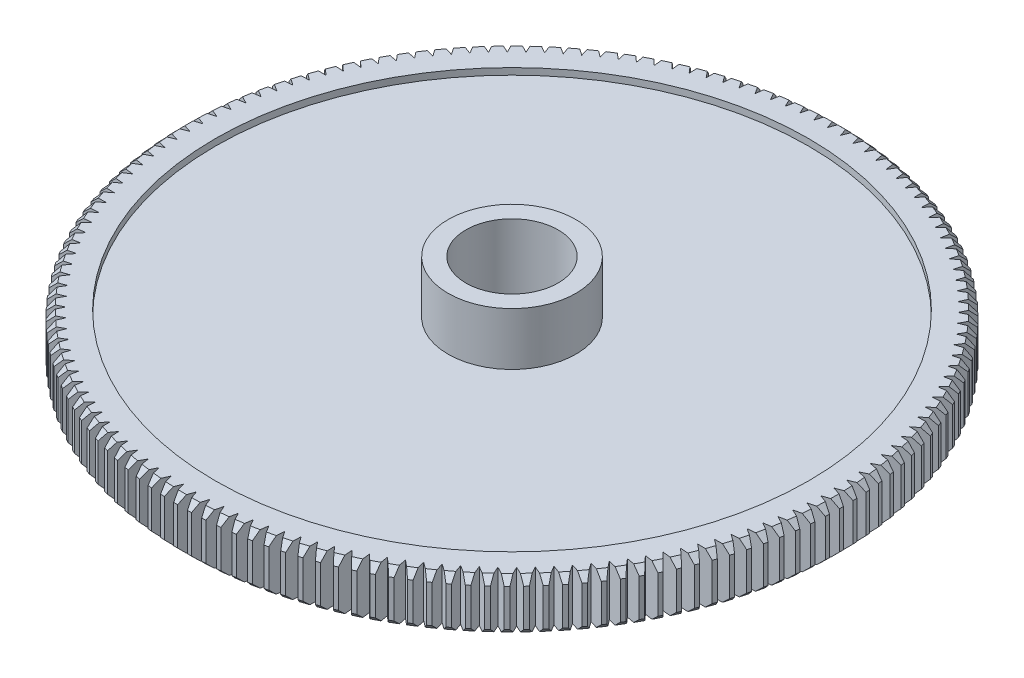
from build123d import *

# Parameters (mm, degrees)
SKETCH_1_R          = 25
EXTRUDE_1_DEPTH     = 3.85
CHAMFER_2_SIZE      = 0.5
CHAMFER_1_SIZE      = 0.5
CUT_EXTRUDE_2_DEPTH = 36.564343098
SKETCH_3_R          = 22.5
CUT_EXTRUDE_3_DEPTH = 0.5
CUT_EXTRUDE_START   = -0.5
SKETCH_4_R          = 22.5
CUT_EXTRUDE_4_DEPTH = 0.5
SKETCH_5_R          = 3.5
CUT_EXTRUDE_5_DEPTH = 36.511758956
EXTRUDE_START       = 4
SKETCH_7_R          = 4.85
SKETCH_7_R_2        = 3.5
EXTRUDE_6_DEPTH     = 4
SKETCH_8_R          = 6.92
SKETCH_8_R_2        = 3.5
EXTRUDE_7_DEPTH     = 9


with BuildPart() as part:
    # Эскиз1 → Вытянуть1 (new body)
    with BuildSketch(Plane(origin=(0, 0, 0), x_dir=(1, 0, 0), z_dir=(0, 1, 0))):
        Circle(SKETCH_1_R)
    extrude(amount=EXTRUDE_1_DEPTH)

    # Фаска2
    chamfer_2_edges = [part.edges().sort_by_distance(p)[0] for p in [
        (-25, 0, 0),
    ]]
    chamfer(chamfer_2_edges, length=CHAMFER_2_SIZE)

    # Фаска1
    chamfer_1_edges = [part.edges().sort_by_distance(p)[0] for p in [
        (-25, 3.85, 0),
    ]]
    chamfer(chamfer_1_edges, length=CHAMFER_1_SIZE)

    # Эскиз2 → Вытянуть2 (cut, through all)
    with BuildSketch(Plane(origin=(0, 3.85, 0), x_dir=(1, 0, 0), z_dir=(0, 1, 0))):
        Polygon((0.562405164, 25.353977291), (1.561527994, 25.312101637), (1.002426509, 23.912456439), align=None)
        Polygon((-0.5, 25.355284493), (0.5, 25.355284493), (0, 23.933454281), align=None)
        Polygon((1.623823677, 25.308182325), (2.620316537, 25.224504481), (2.003094421, 23.84949975), align=None)
        Polygon((2.682393453, 25.217979935), (3.674508154, 25.092646701), (3.000248225, 23.744694662), align=None)
        Polygon((3.736257398, 25.083528366), (4.722253435, 24.916759619), (3.992138574, 23.598225038), align=None)
        Polygon((4.783566679, 24.905063493), (5.76171428, 24.697151802), (4.977025356, 23.410347837), align=None)
        Polygon((5.822483958, 24.682898402), (6.791067119, 24.434208515), (5.953180744, 23.181392657), align=None)
        Polygon((6.851186622, 24.417422848), (7.808506119, 24.128391052), (6.918892229, 22.911761166), align=None)
        Polygon((7.867869976, 24.109102565), (8.812246346, 23.780235918), (7.872465627, 22.601926387), align=None)
        Polygon((8.870750413, 23.758478451), (9.800526899, 23.390353898), (8.812228045, 22.252431877), align=None)
        Polygon((9.85806854, 23.36616562), (10.771613997, 22.959428977), (9.736530821, 21.863890767), align=None)
        Polygon((10.828092264, 22.932852322), (11.723804024, 22.488217143), (10.643752413, 21.43698469), align=None)
        Polygon((11.779119835, 22.459298736), (12.655426515, 21.977545061), (11.532301247, 20.972462586), align=None)
        Polygon((12.709482828, 21.946335635), (13.564847088, 21.428308626), (12.400618505, 20.471139383), align=None)
        Polygon((13.617549068, 21.394862932), (14.450470309, 20.841471382), (13.247180865, 19.933894573), align=None)
        Polygon((14.501725501, 20.805848096), (15.310742495, 20.218062844), (14.070503168, 19.361670665), align=None)
        Polygon((15.360460979, 20.18032446), (16.144154437, 19.55917668), (14.869141028, 18.755471536), align=None)
        Polygon((16.192248989, 19.519389406), (16.949244045, 18.865968802), (15.641693361, 18.116360663), align=None)
        Polygon((16.995630293, 18.824202437), (17.72459892, 18.139655331), (16.38680485, 17.445459266), align=None)
        Polygon((17.769195485, 18.095983148), (18.468858826, 17.381510468), (17.103168314, 16.743944332), align=None)
        Polygon((18.511587471, 17.336009083), (19.180718077, 16.592864257), (17.789527009, 16.013046558), align=None)
        Polygon((19.221503842, 16.545613494), (19.858927832, 15.775100251), (18.444676829, 15.254048186), align=None)
        Polygon((19.897699164, 15.726183004), (20.502298279, 14.929653086), (19.067468419, 14.468280758), align=None)
        Polygon((20.53898716, 14.879155174), (21.109700727, 14.058005964), (19.65680919, 13.657122776), align=None)
        Polygon((21.144242793, 14.006015976), (21.680069588, 13.16168805), (20.211665237, 12.821997288), align=None)
        Polygon((21.71240424, 13.108297194), (22.21240424, 12.242271791), (20.731063157, 11.964369387), align=None)
        Polygon((22.242474752, 12.187573733), (22.705770787, 11.301370154), (21.214091746, 11.085743643), align=None)
        Polygon((22.733524405, 11.245460853), (23.159303696, 10.3406338), (21.659903611, 10.187661466), align=None)
        Polygon((23.184691731, 10.283611341), (23.572207318, 9.361748189), (22.067716644, 9.271698397), align=None)
        Polygon((23.59518523, 9.303712607), (23.943757277, 8.366430618), (22.436815404, 8.339461345), align=None)
        Polygon((23.964284756, 8.307483728), (24.27330175, 7.356427212), (22.766552365, 7.392585771), align=None)
        Polygon((24.291342784, 7.296672427), (24.560262604, 6.33350986), (23.056349057, 6.432732818), align=None)
        Polygon((24.575785542, 6.27305201), (24.804136412, 5.299473107), (23.305697079, 5.461586393), align=None)
        Polygon((24.817114021, 5.238418256), (25.004495336, 4.256131005), (23.514158989, 4.480850216), align=None)
        Polygon((25.01490485, 4.194586263), (25.160987878, 3.20531393), (23.681369073, 3.492244833), align=None)
        Polygon((25.168811035, 3.143387269), (25.273339498, 2.148865373), (23.807033989, 2.497504594), align=None)
        Polygon((25.278562573, 2.086665432), (25.341353093, 1.088638704), (23.890933278, 1.49837461), align=None)
        Polygon((25.343966923, 1.026274603), (25.364909343, 0.026493919), (23.932919752, 0.496607696), align=None)
        Polygon((25.364909343, -0.035924934), (25.343966923, -1.035705617), (23.932919752, -0.50603871), align=None)
        Polygon((25.341353093, -1.098069718), (25.278562573, -2.096096447), (23.890933278, -1.507805625), align=None)
        Polygon((25.273339498, -2.158296388), (25.168811035, -3.152818284), (23.807033989, -2.506935609), align=None)
        Polygon((25.160987878, -3.214744945), (25.01490485, -4.204017278), (23.681369073, -3.501675848), align=None)
        Polygon((25.004495336, -4.26556202), (24.817114021, -5.247849271), (23.514158989, -4.490281231), align=None)
        Polygon((24.804136412, -5.308904122), (24.575785542, -6.282483025), (23.305697079, -5.471017407), align=None)
        Polygon((24.560262604, -6.342940875), (24.291342784, -7.306103442), (23.056349057, -6.442163833), align=None)
        Polygon((24.27330175, -7.365858227), (23.964284756, -8.316914743), (22.766552365, -7.402016786), align=None)
        Polygon((23.943757277, -8.375861633), (23.59518523, -9.313143622), (22.436815404, -8.34889236), align=None)
        Polygon((23.572207318, -9.371179204), (23.184691731, -10.293042356), (22.067716644, -9.281129411), align=None)
        Polygon((23.159303696, -10.350064815), (22.733524405, -11.254891868), (21.659903611, -10.197092481), align=None)
        Polygon((22.705770787, -11.310801168), (22.242474752, -12.197004748), (21.214091746, -11.095174658), align=None)
        Polygon((22.21240424, -12.251702806), (21.71240424, -13.117728209), (20.731063157, -11.973800401), align=None)
        Polygon((21.680069588, -13.171119065), (21.144242793, -14.015446991), (20.211665237, -12.831428303), align=None)
        Polygon((21.109700727, -14.067436979), (20.53898716, -14.888586188), (19.65680919, -13.666553791), align=None)
        Polygon((20.502298279, -14.939084101), (19.897699164, -15.735614019), (19.067468419, -14.477711773), align=None)
        Polygon((19.858927832, -15.784531266), (19.221503842, -16.555044509), (18.444676829, -15.263479201), align=None)
        Polygon((19.180718077, -16.602295272), (18.511587471, -17.345440097), (17.789527009, -16.022477573), align=None)
        Polygon((18.468858826, -17.390941483), (17.769195485, -18.105414163), (17.103168314, -16.753375347), align=None)
        Polygon((17.72459892, -18.149086346), (16.995630293, -18.833633452), (16.38680485, -17.454890281), align=None)
        Polygon((16.949244045, -18.875399817), (16.192248989, -19.528820421), (15.641693361, -18.125791678), align=None)
        Polygon((16.144154437, -19.568607695), (15.360460979, -20.189755475), (14.869141028, -18.764902551), align=None)
        Polygon((15.310742495, -20.227493859), (14.501725501, -20.815279111), (14.070503168, -19.37110168), align=None)
        Polygon((14.450470309, -20.850902397), (13.617549068, -21.404293946), (13.247180865, -19.943325588), align=None)
        Polygon((13.564847088, -21.43773964), (12.709482828, -21.95576665), (12.400618505, -20.480570398), align=None)
        Polygon((12.655426515, -21.986976076), (11.779119835, -22.46872975), (11.532301247, -20.981893601), align=None)
        Polygon((11.723804024, -22.497648158), (10.828092264, -22.942283337), (10.643752413, -21.446415705), align=None)
        Polygon((10.771613997, -22.968859992), (9.85806854, -23.375596635), (9.736530821, -21.873321782), align=None)
        Polygon((9.800526899, -23.399784913), (8.870750413, -23.767909466), (8.812228045, -22.261862892), align=None)
        Polygon((8.812246346, -23.789666933), (7.867869976, -24.11853358), (7.872465627, -22.611357402), align=None)
        Polygon((7.808506119, -24.137822066), (6.851186622, -24.426853863), (6.918892229, -22.921192181), align=None)
        Polygon((6.791067119, -24.44363953), (5.822483958, -24.692329417), (5.953180744, -23.190823672), align=None)
        Polygon((5.76171428, -24.706582817), (4.783566679, -24.914494507), (4.977025356, -23.419778852), align=None)
        Polygon((4.722253435, -24.926190634), (3.736257398, -25.092959381), (3.992138574, -23.607656053), align=None)
        Polygon((3.674508154, -25.102077716), (2.682393453, -25.22741095), (3.000248225, -23.754125677), align=None)
        Polygon((2.620316537, -25.233935496), (1.623823677, -25.31761334), (2.003094421, -23.858930765), align=None)
        Polygon((1.561527994, -25.321532652), (0.562405164, -25.363408306), (1.002426509, -23.921887453), align=None)
        Polygon((0.5, -25.364715507), (-0.5, -25.364715507), (0, -23.942885295), align=None)
        Polygon((-0.562405164, -25.363408306), (-1.561527994, -25.321532652), (-1.002426509, -23.921887453), align=None)
        Polygon((-1.623823677, -25.31761334), (-2.620316537, -25.233935496), (-2.003094421, -23.858930765), align=None)
        Polygon((-2.682393453, -25.22741095), (-3.674508154, -25.102077716), (-3.000248225, -23.754125677), align=None)
        Polygon((-3.736257398, -25.092959381), (-4.722253435, -24.926190634), (-3.992138574, -23.607656053), align=None)
        Polygon((-4.783566679, -24.914494507), (-5.76171428, -24.706582817), (-4.977025356, -23.419778852), align=None)
        Polygon((-5.822483958, -24.692329417), (-6.791067119, -24.44363953), (-5.953180744, -23.190823672), align=None)
        Polygon((-6.851186622, -24.426853863), (-7.808506119, -24.137822066), (-6.918892229, -22.921192181), align=None)
        Polygon((-7.867869976, -24.11853358), (-8.812246346, -23.789666933), (-7.872465627, -22.611357402), align=None)
        Polygon((-8.870750413, -23.767909466), (-9.800526899, -23.399784913), (-8.812228045, -22.261862892), align=None)
        Polygon((-9.85806854, -23.375596635), (-10.771613997, -22.968859992), (-9.736530821, -21.873321782), align=None)
        Polygon((-10.828092264, -22.942283337), (-11.723804024, -22.497648158), (-10.643752413, -21.446415705), align=None)
        Polygon((-11.779119835, -22.46872975), (-12.655426515, -21.986976076), (-11.532301247, -20.981893601), align=None)
        Polygon((-12.709482828, -21.95576665), (-13.564847088, -21.43773964), (-12.400618505, -20.480570398), align=None)
        Polygon((-13.617549068, -21.404293946), (-14.450470309, -20.850902397), (-13.247180865, -19.943325588), align=None)
        Polygon((-14.501725501, -20.815279111), (-15.310742495, -20.227493859), (-14.070503168, -19.37110168), align=None)
        Polygon((-15.360460979, -20.189755475), (-16.144154437, -19.568607695), (-14.869141028, -18.764902551), align=None)
        Polygon((-16.192248989, -19.528820421), (-16.949244045, -18.875399817), (-15.641693361, -18.125791678), align=None)
        Polygon((-16.995630293, -18.833633452), (-17.72459892, -18.149086346), (-16.38680485, -17.454890281), align=None)
        Polygon((-17.769195485, -18.105414163), (-18.468858826, -17.390941483), (-17.103168314, -16.753375347), align=None)
        Polygon((-18.511587471, -17.345440097), (-19.180718077, -16.602295272), (-17.789527009, -16.022477573), align=None)
        Polygon((-19.221503842, -16.555044509), (-19.858927832, -15.784531266), (-18.444676829, -15.263479201), align=None)
        Polygon((-19.897699164, -15.735614019), (-20.502298279, -14.939084101), (-19.067468419, -14.477711773), align=None)
        Polygon((-20.53898716, -14.888586188), (-21.109700727, -14.067436979), (-19.65680919, -13.666553791), align=None)
        Polygon((-21.144242793, -14.015446991), (-21.680069588, -13.171119065), (-20.211665237, -12.831428303), align=None)
        Polygon((-21.71240424, -13.117728209), (-22.21240424, -12.251702806), (-20.731063157, -11.973800401), align=None)
        Polygon((-22.242474752, -12.197004748), (-22.705770787, -11.310801168), (-21.214091746, -11.095174658), align=None)
        Polygon((-22.733524405, -11.254891868), (-23.159303696, -10.350064815), (-21.659903611, -10.197092481), align=None)
        Polygon((-23.184691731, -10.293042356), (-23.572207318, -9.371179204), (-22.067716644, -9.281129411), align=None)
        Polygon((-23.59518523, -9.313143622), (-23.943757277, -8.375861633), (-22.436815404, -8.34889236), align=None)
        Polygon((-23.964284756, -8.316914743), (-24.27330175, -7.365858227), (-22.766552365, -7.402016786), align=None)
        Polygon((-24.291342784, -7.306103442), (-24.560262604, -6.342940875), (-23.056349057, -6.442163833), align=None)
        Polygon((-24.575785542, -6.282483025), (-24.804136412, -5.308904122), (-23.305697079, -5.471017407), align=None)
        Polygon((-24.817114021, -5.247849271), (-25.004495336, -4.26556202), (-23.514158989, -4.490281231), align=None)
        Polygon((-25.01490485, -4.204017278), (-25.160987878, -3.214744945), (-23.681369073, -3.501675848), align=None)
        Polygon((-25.168811035, -3.152818284), (-25.273339498, -2.158296388), (-23.807033989, -2.506935609), align=None)
        Polygon((-25.278562573, -2.096096447), (-25.341353093, -1.098069718), (-23.890933278, -1.507805625), align=None)
        Polygon((-25.343966923, -1.035705617), (-25.364909343, -0.035924934), (-23.932919752, -0.50603871), align=None)
        Polygon((-25.364909343, 0.026493919), (-25.343966923, 1.026274603), (-23.932919752, 0.496607696), align=None)
        Polygon((-25.341353093, 1.088638704), (-25.278562573, 2.086665432), (-23.890933278, 1.49837461), align=None)
        Polygon((-25.273339498, 2.148865373), (-25.168811035, 3.143387269), (-23.807033989, 2.497504594), align=None)
        Polygon((-25.160987878, 3.20531393), (-25.01490485, 4.194586263), (-23.681369073, 3.492244833), align=None)
        Polygon((-25.004495336, 4.256131005), (-24.817114021, 5.238418256), (-23.514158989, 4.480850216), align=None)
        Polygon((-24.804136412, 5.299473107), (-24.575785542, 6.27305201), (-23.305697079, 5.461586393), align=None)
        Polygon((-24.560262604, 6.33350986), (-24.291342784, 7.296672427), (-23.056349057, 6.432732818), align=None)
        Polygon((-24.27330175, 7.356427212), (-23.964284756, 8.307483728), (-22.766552365, 7.392585771), align=None)
        Polygon((-23.943757277, 8.366430618), (-23.59518523, 9.303712607), (-22.436815404, 8.339461345), align=None)
        Polygon((-23.572207318, 9.361748189), (-23.184691731, 10.283611341), (-22.067716644, 9.271698397), align=None)
        Polygon((-23.159303696, 10.3406338), (-22.733524405, 11.245460853), (-21.659903611, 10.187661466), align=None)
        Polygon((-22.705770787, 11.301370154), (-22.242474752, 12.187573733), (-21.214091746, 11.085743643), align=None)
        Polygon((-22.21240424, 12.242271791), (-21.71240424, 13.108297194), (-20.731063157, 11.964369387), align=None)
        Polygon((-21.680069588, 13.16168805), (-21.144242793, 14.006015976), (-20.211665237, 12.821997288), align=None)
        Polygon((-21.109700727, 14.058005964), (-20.53898716, 14.879155174), (-19.65680919, 13.657122776), align=None)
        Polygon((-20.502298279, 14.929653086), (-19.897699164, 15.726183004), (-19.067468419, 14.468280758), align=None)
        Polygon((-19.858927832, 15.775100251), (-19.221503842, 16.545613494), (-18.444676829, 15.254048186), align=None)
        Polygon((-19.180718077, 16.592864257), (-18.511587471, 17.336009083), (-17.789527009, 16.013046558), align=None)
        Polygon((-18.468858826, 17.381510468), (-17.769195485, 18.095983148), (-17.103168314, 16.743944332), align=None)
        Polygon((-17.72459892, 18.139655331), (-16.995630293, 18.824202437), (-16.38680485, 17.445459266), align=None)
        Polygon((-16.949244045, 18.865968802), (-16.192248989, 19.519389406), (-15.641693361, 18.116360663), align=None)
        Polygon((-16.144154437, 19.55917668), (-15.360460979, 20.18032446), (-14.869141028, 18.755471536), align=None)
        Polygon((-15.310742495, 20.218062844), (-14.501725501, 20.805848096), (-14.070503168, 19.361670665), align=None)
        Polygon((-14.450470309, 20.841471382), (-13.617549068, 21.394862932), (-13.247180865, 19.933894573), align=None)
        Polygon((-13.564847088, 21.428308626), (-12.709482828, 21.946335635), (-12.400618505, 20.471139383), align=None)
        Polygon((-12.655426515, 21.977545061), (-11.779119835, 22.459298736), (-11.532301247, 20.972462586), align=None)
        Polygon((-11.723804024, 22.488217143), (-10.828092264, 22.932852322), (-10.643752413, 21.43698469), align=None)
        Polygon((-10.771613997, 22.959428977), (-9.85806854, 23.36616562), (-9.736530821, 21.863890767), align=None)
        Polygon((-9.800526899, 23.390353898), (-8.870750413, 23.758478451), (-8.812228045, 22.252431877), align=None)
        Polygon((-8.812246346, 23.780235918), (-7.867869976, 24.109102565), (-7.872465627, 22.601926387), align=None)
        Polygon((-7.808506119, 24.128391052), (-6.851186622, 24.417422848), (-6.918892229, 22.911761166), align=None)
        Polygon((-6.791067119, 24.434208515), (-5.822483958, 24.682898402), (-5.953180744, 23.181392657), align=None)
        Polygon((-5.76171428, 24.697151802), (-4.783566679, 24.905063493), (-4.977025356, 23.410347837), align=None)
        Polygon((-4.722253435, 24.916759619), (-3.736257398, 25.083528366), (-3.992138574, 23.598225038), align=None)
        Polygon((-3.674508154, 25.092646701), (-2.682393453, 25.217979935), (-3.000248225, 23.744694662), align=None)
        Polygon((-2.620316537, 25.224504481), (-1.623823677, 25.308182325), (-2.003094421, 23.84949975), align=None)
        Polygon((-1.561527994, 25.312101637), (-0.562405164, 25.353977291), (-1.002426509, 23.912456439), align=None)
    extrude(amount=-CUT_EXTRUDE_2_DEPTH, mode=Mode.SUBTRACT)

    # Эскиз3 → Вытянуть3 (cut)
    with BuildSketch(Plane(origin=(0, 3.85, 0), x_dir=(-1, 0, 0), z_dir=(0, 1, 0))):
        Circle(SKETCH_3_R)
    extrude(amount=-CUT_EXTRUDE_3_DEPTH, mode=Mode.SUBTRACT)

    # Эскиз4 → Вытянуть4 (cut)
    with BuildSketch(Plane.XZ.offset(CUT_EXTRUDE_START)):
        Circle(SKETCH_4_R)
    extrude(amount=CUT_EXTRUDE_4_DEPTH, mode=Mode.SUBTRACT)

    # Эскиз5 → Вытянуть5 (cut, through all)
    with BuildSketch(Plane(origin=(0, 3.35, 0), x_dir=(1, 0, 0), z_dir=(0, 1, 0))):
        Circle(SKETCH_5_R)
    extrude(amount=-CUT_EXTRUDE_5_DEPTH, mode=Mode.SUBTRACT)

    # Эскиз7 → Вытянуть6 (add)
    with BuildSketch(Plane(origin=(0, 3.35, 0), x_dir=(1, 0, 0), z_dir=(0, 1, 0)).offset(EXTRUDE_START)):
        Circle(SKETCH_7_R)
        Circle(SKETCH_7_R_2, mode=Mode.SUBTRACT)
    extrude(amount=-EXTRUDE_6_DEPTH)

    # Эскиз8 → Вытянуть7 (add)
    with BuildSketch(Plane.XZ.offset(-0.5)):
        Circle(SKETCH_8_R)
        Circle(SKETCH_8_R_2, mode=Mode.SUBTRACT)
    extrude(amount=EXTRUDE_7_DEPTH)


solid = part.part
